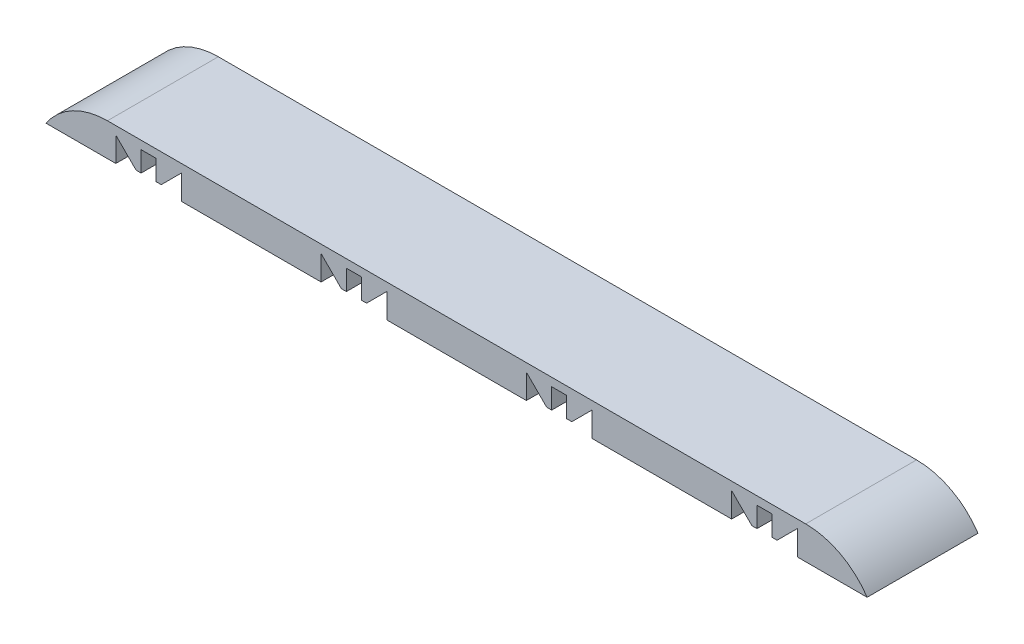
from build123d import *

# Parameters (mm, degrees)
SKETCH1_W           = 254
SKETCH1_H           = 34.29
BOSS_EXTRUDE1_DEPTH = 10.16
FILLET1_R           = 22.86
CUT_EXTRUDE2_DEPTH  = 50.8
LPATTERN1_COUNT     = 4
LPATTERN1_PITCH     = 63.5


with BuildPart() as part:
    # Sketch1 → Boss-Extrude1 (new body)
    with BuildSketch(Plane(origin=(0, 0, 0), x_dir=(1, 0, 0), z_dir=(0, 1, 0))):
        Rectangle(SKETCH1_W, SKETCH1_H)
    extrude(amount=BOSS_EXTRUDE1_DEPTH)

    # Fillet1
    # the kernel refuses this fillet: 22.86 mm, written as the material it takes off along each edge
    with BuildSketch(Plane(origin=(-127, 10.16, 64.664048812), x_dir=(0, -1, 0), z_dir=(0, 0, -1)), Plane(origin=(127, 10.16, -64.664048812), x_dir=(0, -1, 0), z_dir=(0, 0, 1))) as fillet1_piece_1:
        with BuildLine():
            CenterArc((22.86, -19.007619525), FILLET1_R, 123.748988596, 56.251011404)
            Line((0, -19.007619525), (-0.4572, -19.007619525))
            Line((-0.4572, -19.007619525), (-0.4572, 0))
            Line((-0.4572, 0), (0, 0.4572))
            ThreePointArc((0, 0.4572), (5.08, 0.4572), (9.906, 0.38015239))
            Line((9.906, 0.38015239), (10.16, 0))
        make_face()
    extrude(amount=129.328097624, mode=Mode.SUBTRACT)

    # Sketch2 → Cut-Extrude2 (cut)
    with BuildSketch(Plane.XY.offset(17.145)):
        Polygon((-85.09, 0), (-85.09, 7.62), (-91.35478418, 1.35521582), (-92.92396906, 1.35521582), (-92.92396906, 7.62), (-97.57603094, 7.62), (-97.57603094, 1.35521582), (-99.14521582, 1.35521582), (-105.41, 7.62), (-105.41, 0), align=None)
    cut_extrude2 = extrude(amount=-CUT_EXTRUDE2_DEPTH, mode=Mode.SUBTRACT)

    # LPattern1: Cut-Extrude2 ×4
    with Locations(*[(i * LPATTERN1_PITCH, 0, 0) for i in range(1, LPATTERN1_COUNT)]):
        add(cut_extrude2, mode=Mode.SUBTRACT)


solid = part.part
